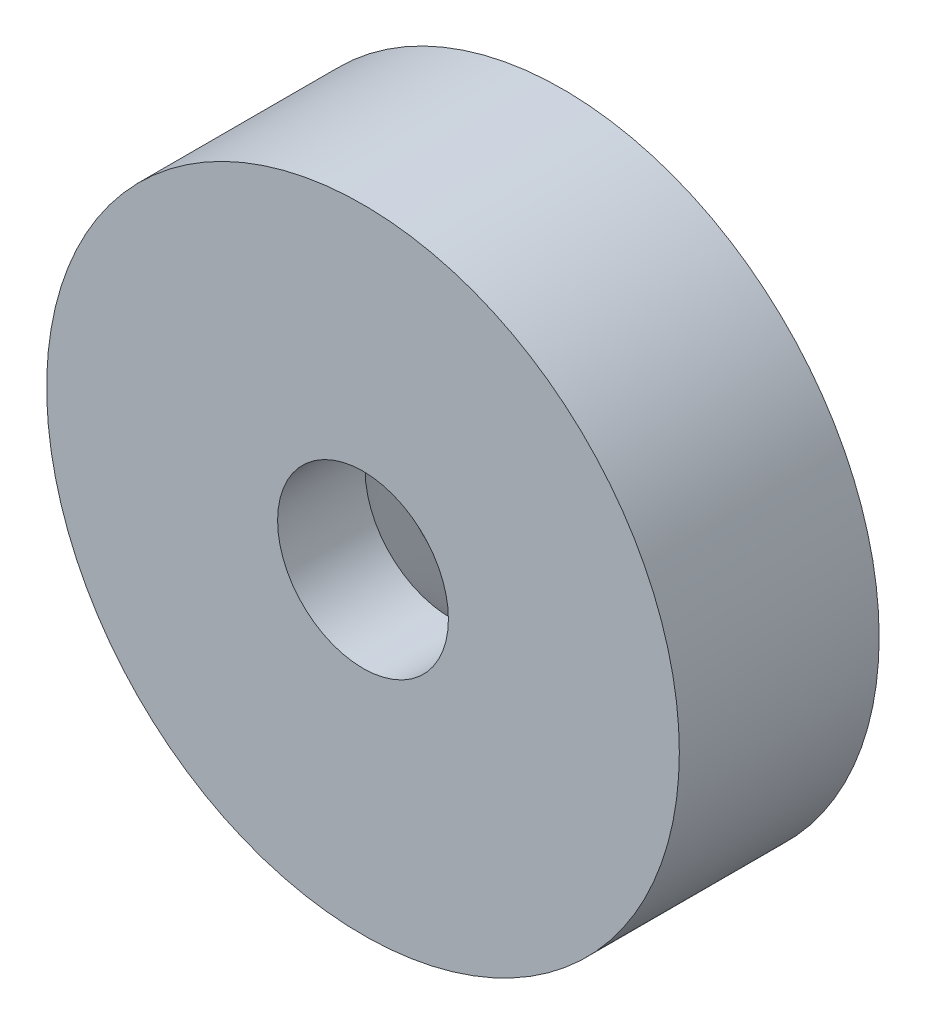
from build123d import *

# Parameters (mm, degrees)
SKETCH1_R           = 6
SKETCH1_R_2         = 1.62
BOSS_EXTRUDE1_DEPTH = 3.79


with BuildPart() as part:
    # Sketch1 → Boss-Extrude1 (new body)
    with BuildSketch(Plane.XY):
        with Locations((5.056285212, 23.07899143)):
            Circle(SKETCH1_R)
        with Locations((5.056285212, 23.07899143)):
            Circle(SKETCH1_R_2, mode=Mode.SUBTRACT)
    extrude(amount=BOSS_EXTRUDE1_DEPTH)

    # Cut-Extrude1 cone 1 section (through the dimple's axis) → Cut-Extrude1 (revolve, cut)
    with BuildSketch(Plane(origin=(5.056285212, 23.07899143, 0), x_dir=(0, 1, 0), z_dir=(1, 0, 0))):
        Polygon((0, 0), (3.75, 0), (0, 3.75), align=None)
    revolve(axis=Axis((5.056285212, 23.07899143, 0), (0, 0, 1)), mode=Mode.SUBTRACT)


solid = part.part
